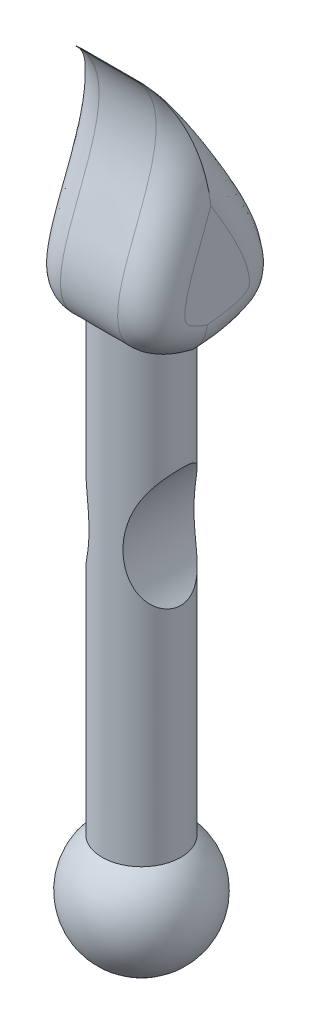
from build123d import *

# Parameters (mm, degrees)
BOSS_EXTRU_1_DEPTH           = 5
BOSS_EXTRU_1_DEPTH_BACK      = 5
CONG_3_R                     = 2.7
BOSS_EXTRU_3_DEPTH           = 2
BOSS_EXTRU_3_DEPTH_BACK      = 40
ESQUISSE9_R                  = 3.166877074
ENL_V_MAT_EXTRU_3_DEPTH      = 40
ENL_V_MAT_EXTRU_3_DEPTH_BACK = 40


with BuildPart() as part:
    # Esquisse2 → Boss.-Extru.1 (new, two sides: drawn at the far end of the back side and taken through both)
    with BuildSketch(Plane(origin=(0, 0, 0), x_dir=(0, 0, -1), z_dir=(1, 0, 0)).offset(-BOSS_EXTRU_1_DEPTH_BACK)):
        with BuildLine():
            add(Edge.make_bspline(
                [(0, 0), (-10.931547, 2.874100023), (3.63146396, 13.823592657), (-2.854170523, 20)],
                knots=[0, 0, 0, 0, 1, 1, 1, 1], degree=3))
            add(Edge.make_bspline(
                [(0, 0), (9.061611307, 0.425941794), (5.173159587, 9.382817132), (-1.468938134, 18.999736941), (-2.854170523, 20)],
                knots=[0, 0, 0, 0, 0.58899314, 1, 1, 1, 1], degree=3))
        make_face()
    extrude(amount=BOSS_EXTRU_1_DEPTH + BOSS_EXTRU_1_DEPTH_BACK)

    # Congé3
    cong_3_edges = [part.edges().sort_by_distance(p)[0] for p in [
        (5, 9.156781483, 2.943633742),
        (5, 8.871615255, -4.829386875),
        (-5, 9.156781483, 2.943633742),
        (-5, 8.871615255, -4.829386875),
    ]]
    fillet(cong_3_edges, radius=CONG_3_R)

    # Esquisse9 → Boss.-Extru.3 (add, two sides: drawn at the far end of the back side and taken through both)
    with BuildSketch(Plane(origin=(0, 0, 0), x_dir=(1, 0, 0), z_dir=(0, 1, 0)).offset(-BOSS_EXTRU_3_DEPTH_BACK)):
        with Locations(Location((0, 0, 0), (0, 0, 136.574394023))):
            Circle(ESQUISSE9_R)
    extrude(amount=BOSS_EXTRU_3_DEPTH + BOSS_EXTRU_3_DEPTH_BACK)

    # Esquisse10 → Enlèv. mat.-Extru.3 (cut, two sides: drawn at the far end of the back side and taken through both)
    with BuildSketch(Plane.XY.offset(-ENL_V_MAT_EXTRU_3_DEPTH_BACK)):
        with BuildLine():
            Line((3.166877074, -17.599750379), (3.166877074, -8.06575841))
            add(Edge.make_bspline(
                [(3.166877074, -8.06575841), (1.130130058, -10.760290134), (0.430113803, -14.872577394), (3.166877074, -17.599750379)],
                knots=[0, 0, 0, 0, 1, 1, 1, 1], degree=3))
        make_face()
        with BuildLine():
            Line((-3.166877074, -17.599750379), (-3.166877074, -8.06575841))
            add(Edge.make_bspline(
                [(-3.166877074, -8.06575841), (-1.130130058, -10.760290134), (-0.430113803, -14.872577394), (-3.166877074, -17.599750379)],
                knots=[0, 0, 0, 0, 1, 1, 1, 1], degree=3))
        make_face()
    extrude(amount=ENL_V_MAT_EXTRU_3_DEPTH + ENL_V_MAT_EXTRU_3_DEPTH_BACK, mode=Mode.SUBTRACT)

    # Esquisse12 → Révolution1 (revolve)
    with BuildSketch(Plane.XY):
        with BuildLine():
            ThreePointArc((0, -44.024117945), (-5, -39.024117945), (0, -34.024117945))
            Line((0, -34.024117945), (0, -44.024117945))
        make_face()
    revolve(axis=Axis((0, -44.024117945, 0), (0, 1, 0)))


solid = part.part
